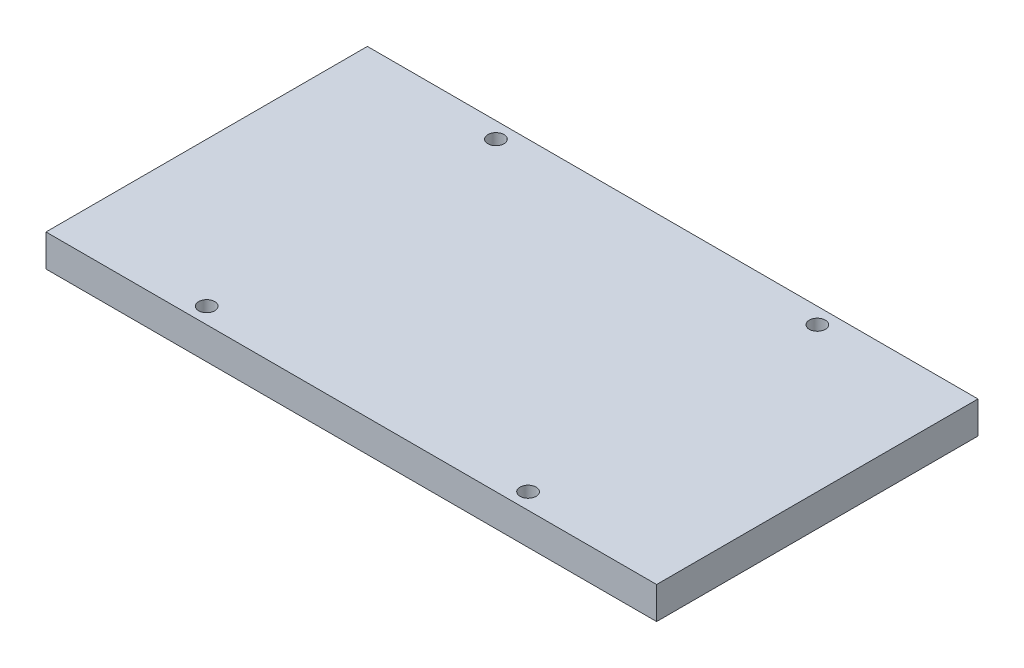
from build123d import *

# Parameters (mm, degrees)
SKETCH1_W              = 965.2
SKETCH1_H              = 508
BOSS_EXTRUDE1_DEPTH    = 50.8
CUT_EXTRUDE3_START     = 31.75
CUT_EXTRUDE3_OUTLINE_R = 12.7
CUT_EXTRUDE3_DEPTH     = 19.05


# Read off the part's stored shape, not the designer's step: Cut-Extrude3
with BuildPart() as part:
    # Sketch1 → Boss-Extrude1 (new body)
    with BuildSketch(Plane(origin=(0, 0, 0), x_dir=(1, 0, 0), z_dir=(0, 1, 0))):
        Rectangle(SKETCH1_W, SKETCH1_H)
    extrude(amount=BOSS_EXTRUDE1_DEPTH)

    # Cut-Extrude3 outline → Cut-Extrude3 (cut)
    with BuildSketch(Plane(origin=(0, 0, 0), x_dir=(1, 0, 0), z_dir=(0, 1, 0)).offset(CUT_EXTRUDE3_START)):
        with Locations((-254, 228.6)):
            Circle(CUT_EXTRUDE3_OUTLINE_R)
        with Locations((-254, -228.6)):
            Circle(CUT_EXTRUDE3_OUTLINE_R)
        with Locations((254, -228.6)):
            Circle(CUT_EXTRUDE3_OUTLINE_R)
        with Locations((254, 228.6)):
            Circle(CUT_EXTRUDE3_OUTLINE_R)
    extrude(amount=CUT_EXTRUDE3_DEPTH, mode=Mode.SUBTRACT)


solid = part.part
